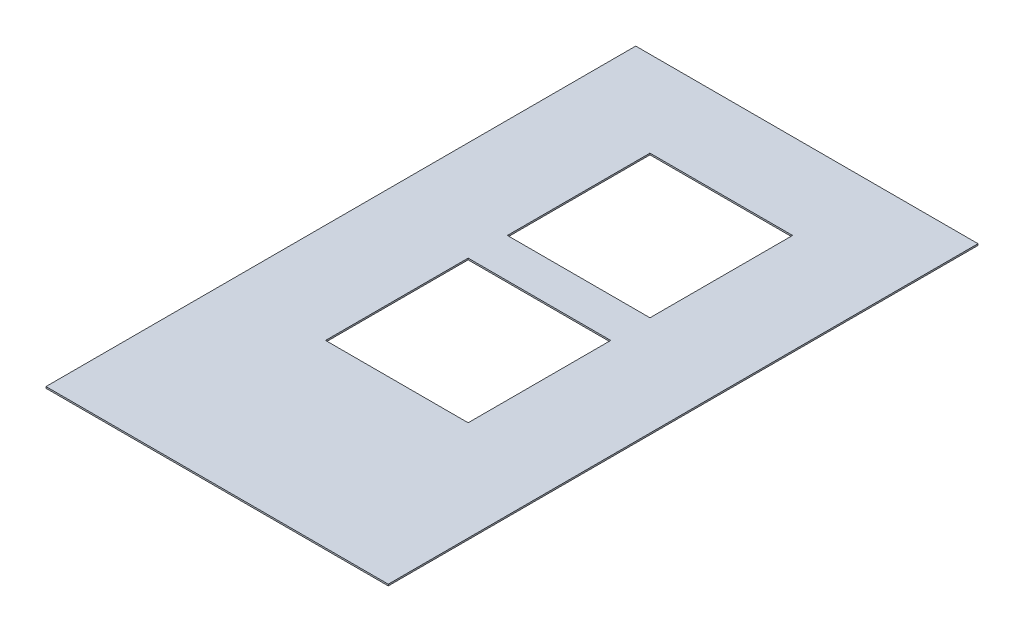
from build123d import *

# Parameters (mm, degrees)
SKETCH1_W               = 1219.2
SKETCH1_H               = 2100.58
BOSS_EXTRUDE1_DEPTH     = 5.55625
CUT_EXTRUDE1_DEPTH      = 1215.393723639
CUT_EXTRUDE1_DEPTH_BACK = 1215.393723639
SKETCH2_W               = 508
SKETCH2_H               = 508


with BuildPart() as part:
    # Sketch1 → Boss-Extrude1 (new body)
    with BuildSketch(Plane(origin=(0, 0, 0), x_dir=(1, 0, 0), z_dir=(0, 1, 0))):
        Rectangle(SKETCH1_W, SKETCH1_H)
    extrude(amount=BOSS_EXTRUDE1_DEPTH)

    # Sketch2 → Cut-Extrude1 (cut, two sides: drawn at the far end of the back side and taken through both)
    with BuildSketch(Plane(origin=(0, 0, 0), x_dir=(-1, 0, 0), z_dir=(0, -1, 0)).offset(-CUT_EXTRUDE1_DEPTH_BACK)):
        with Locations((0, 491.49)):
            Rectangle(SKETCH2_W, SKETCH2_H)
        with Locations((0, -156.21)):
            Rectangle(SKETCH2_W, SKETCH2_H)
    extrude(amount=CUT_EXTRUDE1_DEPTH + CUT_EXTRUDE1_DEPTH_BACK, mode=Mode.SUBTRACT)


solid = part.part
